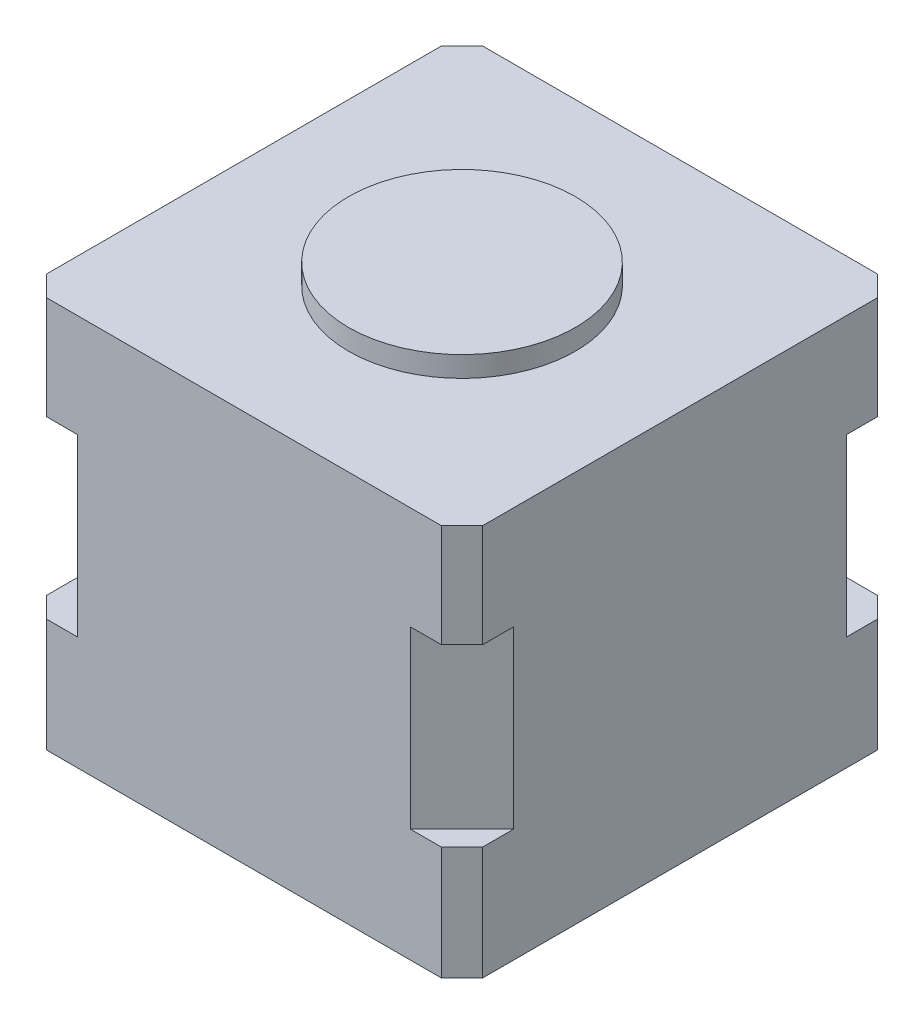
from build123d import *

# Parameters (mm, degrees)
BOSS_EXTRUDE1_DEPTH = 11
BOSS_EXTRUDE2_DEPTH = 17
BOSS_EXTRUDE3_DEPTH = 10
SKETCH4_R           = 11
BOSS_EXTRUDE4_DEPTH = 2
SKETCH8_R           = 1.5
CUT_EXTRUDE2_DEPTH  = 4.5


with BuildPart() as part:
    # Sketch1 → Boss-Extrude1 (new body)
    with BuildSketch(Plane(origin=(0, 0, 0), x_dir=(1, 0, 0), z_dir=(0, 1, 0))):
        Polygon((19.15, -21.15), (21.15, -19.15), (21.15, 19.15), (19.15, 21.15), (-19.15, 21.15), (-21.15, 19.15), (-21.15, -19.15), (-19.15, -21.15), align=None)
    extrude(amount=BOSS_EXTRUDE1_DEPTH)

    # Sketch2 → Boss-Extrude2 (add)
    with BuildSketch(Plane(origin=(0, 11, 0), x_dir=(1, 0, 0), z_dir=(0, 1, 0))):
        Polygon((16.15, -21.15), (21.15, -16.15), (21.15, 16.15), (16.15, 21.15), (-16.15, 21.15), (-21.15, 16.15), (-21.15, -16.15), (-16.15, -21.15), align=None)
    extrude(amount=BOSS_EXTRUDE2_DEPTH)

    # Sketch3 → Boss-Extrude3 (add)
    with BuildSketch(Plane(origin=(0, 28, 0), x_dir=(1, 0, 0), z_dir=(0, 1, 0))):
        Polygon((19.15, -21.15), (21.15, -19.15), (21.15, 19.15), (19.15, 21.15), (-19.15, 21.15), (-21.15, 19.15), (-21.15, -19.15), (-19.15, -21.15), align=None)
    extrude(amount=BOSS_EXTRUDE3_DEPTH)

    # Sketch4 → Boss-Extrude4 (add)
    with BuildSketch(Plane(origin=(0, 38, 0), x_dir=(1, 0, 0), z_dir=(0, 1, 0))):
        Circle(SKETCH4_R)
    extrude(amount=BOSS_EXTRUDE4_DEPTH)

    # Sketch8 → Cut-Extrude2 (cut)
    with BuildSketch(Plane.XZ):
        with Locations((-15.5, 15.5)):
            Circle(SKETCH8_R)
        with Locations((15.5, 15.5)):
            Circle(SKETCH8_R)
        with Locations((15.5, -15.5)):
            Circle(SKETCH8_R)
        with Locations((-15.5, -15.5)):
            Circle(SKETCH8_R)
    extrude(amount=-CUT_EXTRUDE2_DEPTH, mode=Mode.SUBTRACT)


solid = part.part
